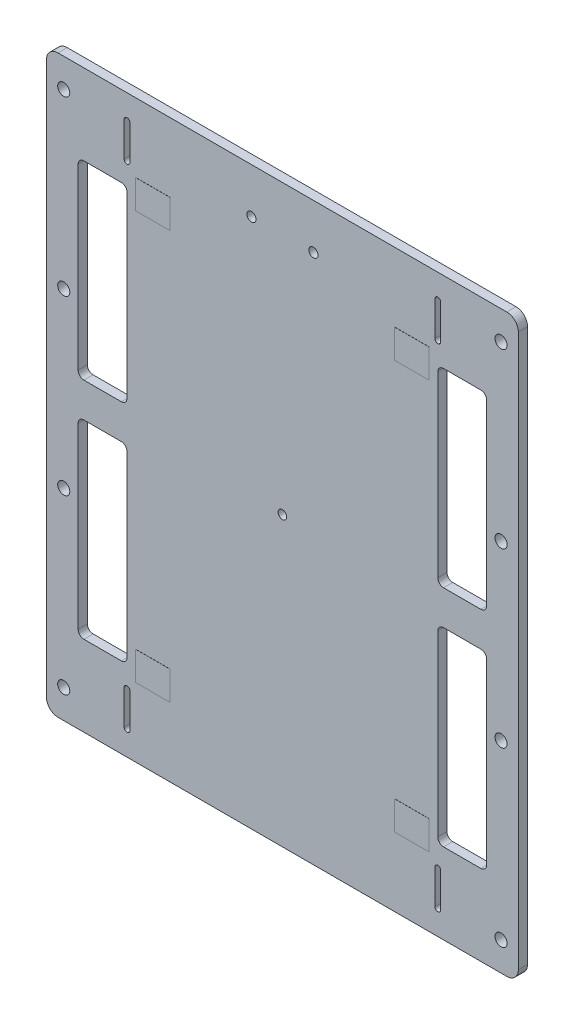
from build123d import *

# Parameters (mm, degrees)
BOARDOUTLINE_DEPTH          = 1.6
SKETCH2_R                   = 0.75
SKETCH2_R_2                 = 0.8
COMPONENTHOLES_DEPTH        = 65.680445267
SOLARCELLCONTACTHOLES_DEPTH = 1.6
WINDOWS_DEPTH               = 65.680445267
SKETCH5_W                   = 6
SKETCH5_H                   = 5
CONTACTPADS_DEPTH           = 0.02
M2_CLEARANCE_HOLE1_D        = 2.1


with BuildPart() as part:
    # Sketch1 → boardOutline (new body)
    with BuildSketch(Plane.XY):
        with BuildLine():
            Line((-39, -50), (39, -50))
            ThreePointArc((39, -50), (40.414213562, -49.414213562), (41, -48))
            Line((41, -48), (41, 48))
            ThreePointArc((41, 48), (40.414213562, 49.414213562), (39, 50))
            Line((39, 50), (-39, 50))
            ThreePointArc((-39, 50), (-40.414213562, 49.414213562), (-41, 48))
            Line((-41, 48), (-41, -48))
            ThreePointArc((-41, -48), (-40.414213562, -49.414213562), (-39, -50))
        make_face()
    extrude(amount=BOARDOUTLINE_DEPTH)

    # Sketch2 → componentHoles (cut, through all)
    with BuildSketch(Plane.XY.offset(1.6)):
        Circle(SKETCH2_R)
        with Locations((-5.38, 42.15)):
            Circle(SKETCH2_R_2)
        with Locations((5.39, 42.15)):
            Circle(SKETCH2_R_2)
    extrude(amount=-COMPONENTHOLES_DEPTH, mode=Mode.SUBTRACT)

    # Sketch4 → solarCellContactHoles (cut)
    with BuildSketch(Plane.XY.offset(1.6)):
        with BuildLine():
            Line((-27.5, 39.75), (-27.5, 45.75))
            ThreePointArc((-27.5, 45.75), (-27, 46.25), (-26.5, 45.75))
            Line((-26.5, 45.75), (-26.5, 39.75))
            ThreePointArc((-26.5, 39.75), (-27, 39.25), (-27.5, 39.75))
        make_face()
        with BuildLine():
            Line((26.5, 39.75), (26.5, 45.75))
            ThreePointArc((26.5, 45.75), (27, 46.25), (27.5, 45.75))
            Line((27.5, 45.75), (27.5, 39.75))
            ThreePointArc((27.5, 39.75), (27, 39.25), (26.5, 39.75))
        make_face()
        with BuildLine():
            Line((26.5, -45.75), (26.5, -39.75))
            ThreePointArc((26.5, -39.75), (27, -39.25), (27.5, -39.75))
            Line((27.5, -39.75), (27.5, -45.75))
            ThreePointArc((27.5, -45.75), (27, -46.25), (26.5, -45.75))
        make_face()
        with BuildLine():
            Line((-27.5, -45.75), (-27.5, -39.75))
            ThreePointArc((-27.5, -39.75), (-27, -39.25), (-26.5, -39.75))
            Line((-26.5, -39.75), (-26.5, -45.75))
            ThreePointArc((-26.5, -45.75), (-27, -46.25), (-27.5, -45.75))
        make_face()
    extrude(amount=-SOLARCELLCONTACTHOLES_DEPTH, mode=Mode.SUBTRACT)

    # Sketch3 → windows (cut, through all)
    with BuildSketch(Plane.XY.offset(1.6)):
        with BuildLine():
            Line((-34.5, 36), (-28, 36))
            ThreePointArc((-28, 36), (-27.292893219, 35.707106781), (-27, 35))
            Line((-27, 35), (-27, 4))
            ThreePointArc((-27, 4), (-27.292893219, 3.292893219), (-28, 3))
            Line((-28, 3), (-34.5, 3))
            ThreePointArc((-34.5, 3), (-35.207106781, 3.292893219), (-35.5, 4))
            Line((-35.5, 4), (-35.5, 35))
            ThreePointArc((-35.5, 35), (-35.207106781, 35.707106781), (-34.5, 36))
        make_face()
        with BuildLine():
            Line((-34.5, -36), (-28, -36))
            ThreePointArc((-28, -36), (-27.292893219, -35.707106781), (-27, -35))
            Line((-27, -35), (-27, -4))
            ThreePointArc((-27, -4), (-27.292893219, -3.292893219), (-28, -3))
            Line((-28, -3), (-34.5, -3))
            ThreePointArc((-34.5, -3), (-35.207106781, -3.292893219), (-35.5, -4))
            Line((-35.5, -4), (-35.5, -35))
            ThreePointArc((-35.5, -35), (-35.207106781, -35.707106781), (-34.5, -36))
        make_face()
        with BuildLine():
            Line((34.5, -36), (28, -36))
            ThreePointArc((28, -36), (27.292893219, -35.707106781), (27, -35))
            Line((27, -35), (27, -4))
            ThreePointArc((27, -4), (27.292893219, -3.292893219), (28, -3))
            Line((28, -3), (34.5, -3))
            ThreePointArc((34.5, -3), (35.207106781, -3.292893219), (35.5, -4))
            Line((35.5, -4), (35.5, -35))
            ThreePointArc((35.5, -35), (35.207106781, -35.707106781), (34.5, -36))
        make_face()
        with BuildLine():
            Line((34.5, 36), (28, 36))
            ThreePointArc((28, 36), (27.292893219, 35.707106781), (27, 35))
            Line((27, 35), (27, 4))
            ThreePointArc((27, 4), (27.292893219, 3.292893219), (28, 3))
            Line((28, 3), (34.5, 3))
            ThreePointArc((34.5, 3), (35.207106781, 3.292893219), (35.5, 4))
            Line((35.5, 4), (35.5, 35))
            ThreePointArc((35.5, 35), (35.207106781, 35.707106781), (34.5, 36))
        make_face()
    extrude(amount=-WINDOWS_DEPTH, mode=Mode.SUBTRACT)

    # Sketch5 → contactPads (add)
    with BuildSketch(Plane.XY.offset(1.6)):
        with Locations((-22.5, 35.5)):
            Rectangle(SKETCH5_W, SKETCH5_H)
        with Locations((22.5, 35.5)):
            Rectangle(SKETCH5_W, SKETCH5_H)
        with Locations((22.5, -35.5)):
            Rectangle(SKETCH5_W, SKETCH5_H)
        with Locations((-22.5, -35.5)):
            Rectangle(SKETCH5_W, SKETCH5_H)
    extrude(amount=CONTACTPADS_DEPTH)

    # M2 Clearance Hole1 (through all)
    with Locations(Plane(origin=(0, 0, 0), x_dir=(-1, 0, 0), z_dir=(0, 0, -1))):
        with Locations((-38, 45), (-38, -15), (-38, -45), (-38, 15), (38, -45), (38, -15), (38, 15), (38, 45)):
            Hole(M2_CLEARANCE_HOLE1_D / 2)


solid = part.part
